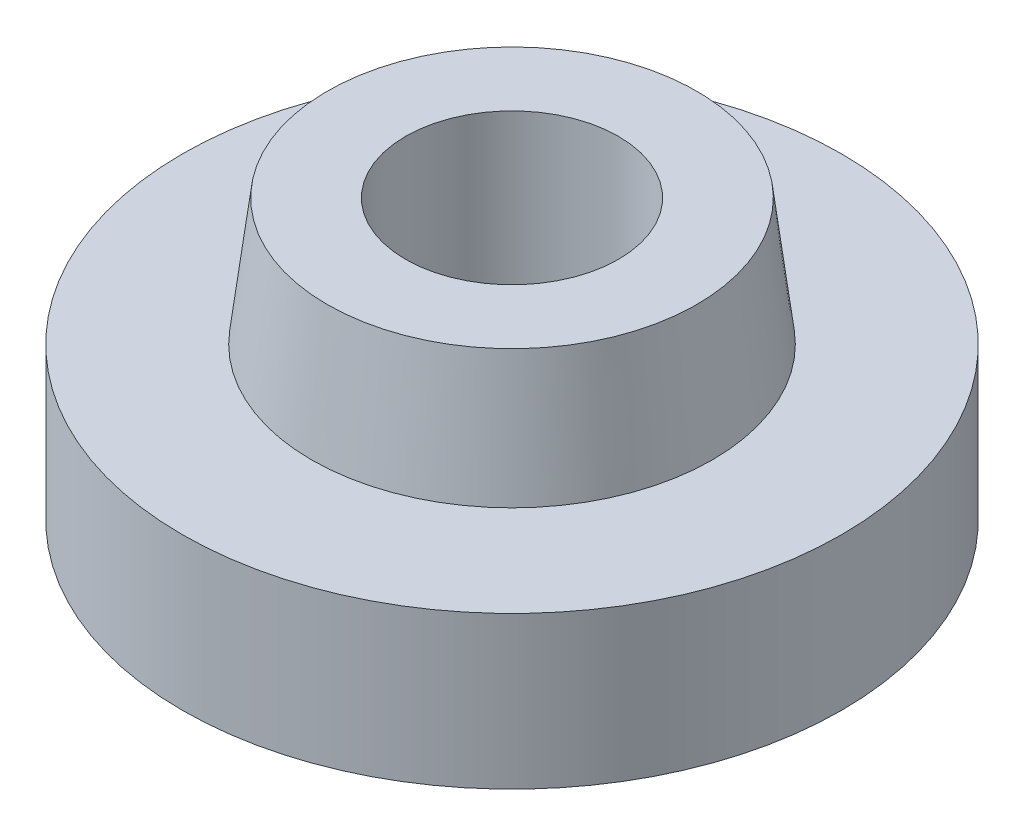
from build123d import *
from build123d.topology import SkipClean

# Parameters (mm, degrees)
SKETCH1_R           = 3.95
SKETCH1_R_2         = 2.1
BOSS_EXTRUDE1_DEPTH = 2.5
BOSS_EXTRUDE2_START = 3
SKETCH2_R           = 6.5
SKETCH2_R_2         = 2.1
BOSS_EXTRUDE2_DEPTH = 3
CHAMFER1_SIZE       = 2.5
CHAMFER1_SIZE_2     = 0.306961402


with BuildPart() as part:
    # Sketch1 → Boss-Extrude1 (new body)
    with BuildSketch(Plane(origin=(0, 0, 0), x_dir=(1, 0, 0), z_dir=(0, 1, 0))):
        with Locations(Location((0, 0, 0), (0, 0, 270))):
            Circle(SKETCH1_R)
        with Locations(Location((0, 0, 0), (0, 0, 270))):
            Circle(SKETCH1_R_2, mode=Mode.SUBTRACT)
    extrude(amount=BOSS_EXTRUDE1_DEPTH)

    # Sketch2 → Boss-Extrude2 (add)
    with SkipClean():  # the faces are left unmerged after this step: merging them gives an invalid solid
        with BuildSketch(Plane.XZ.offset(BOSS_EXTRUDE2_START)):
            with Locations(Location((0, 0, 0), (0, 0, 270))):
                Circle(SKETCH2_R)
            with Locations(Location((0, 0, 0), (0, 0, 270))):
                Circle(SKETCH2_R_2, mode=Mode.SUBTRACT)
        extrude(amount=-BOSS_EXTRUDE2_DEPTH)

    # Chamfer1
    # the kernel refuses this chamfer: 2.5, 0.306961402 mm, written as the material it takes off along each edge
    with BuildSketch(Plane(origin=(0, 2.5, 0), x_dir=(0, 0, 1), z_dir=(-1, 0, 0))) as chamfer1_piece_1_section:
        Polygon((3.95, -CHAMFER1_SIZE), (3.95 - CHAMFER1_SIZE_2, 0), (3.95, 0), align=None)
    chamfer1_piece_1 = revolve(axis=Axis((0, 2.5, 0), (0, 1, 0)), mode=Mode.PRIVATE)
    chamfer1_piece_1 = split(chamfer1_piece_1, bisect_by=Plane(origin=(0, 0, -3.813772666), z_dir=(0, 1, 0)), keep=Keep.TOP, mode=Mode.PRIVATE)
    add(chamfer1_piece_1, mode=Mode.SUBTRACT)


solid = part.part
